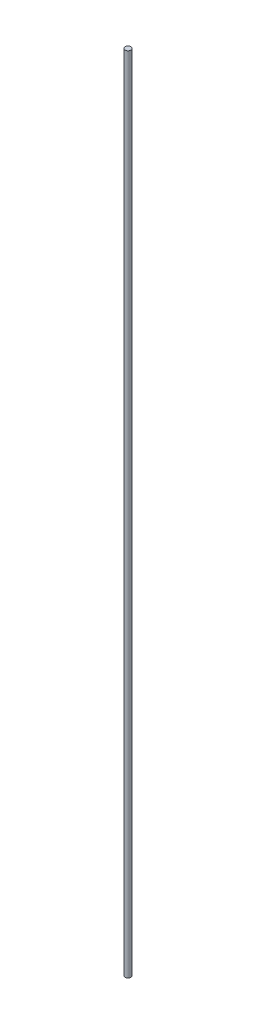
from build123d import *

# Parameters (mm, degrees)
SKETCH1_R           = 5.5
BOSS_EXTRUDE1_DEPTH = 1500


with BuildPart() as part:
    # Sketch1 → Boss-Extrude1 (new body)
    with BuildSketch(Plane(origin=(0, 0, 0), x_dir=(1, 0, 0), z_dir=(0, 1, 0))):
        Circle(SKETCH1_R)
    extrude(amount=BOSS_EXTRUDE1_DEPTH)


solid = part.part
